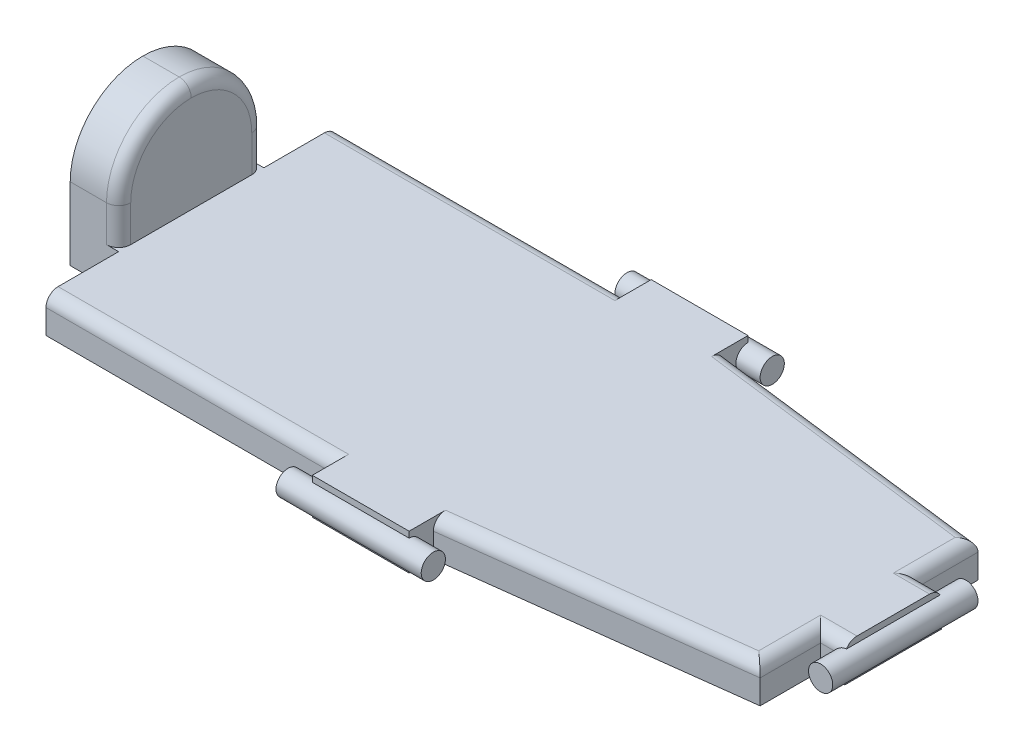
from build123d import *

# Parameters (mm, degrees)
BOSS_EXTRUDE2_DEPTH = 15
SKETCH3_W           = 40
SKETCH3_H           = 15
BOSS_EXTRUDE3_DEPTH = 10
BOSS_EXTRUDE4_START = -50
SKETCH4_R           = 5
BOSS_EXTRUDE4_DEPTH = 60
SKETCH5_W           = 20
SKETCH5_H           = 15
BOSS_EXTRUDE5_DEPTH = 10
BOSS_EXTRUDE6_START = -20
SKETCH6_R           = 5
BOSS_EXTRUDE6_DEPTH = 30
SKETCH7_W           = 20
SKETCH7_H           = 60
BOSS_EXTRUDE7_DEPTH = 60
SKETCH9_R           = 15
CUT_EXTRUDE1_DEPTH  = 5
SKETCH10_R          = 18
CUT_EXTRUDE2_DEPTH  = 5
FILLET1_R           = 30
FILLET2_R           = 5


with BuildPart() as part:
    # Sketch1 → Boss-Extrude2 (new body)
    with BuildSketch(Plane(origin=(0, 0, 0), x_dir=(1, 0, 0), z_dir=(0, 1, 0))):
        Polygon((0, 0), (300, 0), (300, -45), (180, -60), (20, -60), (20, -30), (0, -30), align=None)
    boss_extrude2 = extrude(amount=BOSS_EXTRUDE2_DEPTH)

    # Sketch3 → Boss-Extrude3 (add)
    with BuildSketch(Plane.XY.offset(60)):
        with Locations((160, 7.5)):
            Rectangle(SKETCH3_W, SKETCH3_H)
    boss_extrude3 = extrude(amount=BOSS_EXTRUDE3_DEPTH)

    # Sketch4 → Boss-Extrude4 (add)
    with BuildSketch(Plane(origin=(180, 0, 0), x_dir=(0, 0, -1), z_dir=(1, 0, 0)).offset(BOSS_EXTRUDE4_START)):
        with Locations((-70, 7.5)):
            Circle(SKETCH4_R)
    boss_extrude4 = extrude(amount=BOSS_EXTRUDE4_DEPTH)

    # Sketch5 → Boss-Extrude5 (add)
    with BuildSketch(Plane(origin=(300, 0, 0), x_dir=(0, 0, -1), z_dir=(1, 0, 0))):
        with Locations((-10, 7.5)):
            Rectangle(SKETCH5_W, SKETCH5_H)
    boss_extrude5 = extrude(amount=BOSS_EXTRUDE5_DEPTH)

    # Sketch6 → Boss-Extrude6 (add)
    with BuildSketch(Plane.XY.offset(20).offset(BOSS_EXTRUDE6_START)):
        with Locations((310, 7.5)):
            Circle(SKETCH6_R)
    boss_extrude6 = extrude(amount=BOSS_EXTRUDE6_DEPTH)

    # Mirror1: Boss-Extrude2, Boss-Extrude3, Boss-Extrude4, Boss-Extrude5, Boss-Extrude6 across plane
    add(boss_extrude2.mirror(Plane(origin=(0, 15, 0), x_dir=(1, 0, 0), z_dir=(0, 0, 1))))
    add(boss_extrude3.mirror(Plane(origin=(0, 15, 0), x_dir=(1, 0, 0), z_dir=(0, 0, 1))))
    add(boss_extrude4.mirror(Plane(origin=(0, 15, 0), x_dir=(1, 0, 0), z_dir=(0, 0, 1))))
    add(boss_extrude5.mirror(Plane(origin=(0, 15, 0), x_dir=(1, 0, 0), z_dir=(0, 0, 1))))
    add(boss_extrude6.mirror(Plane(origin=(0, 15, 0), x_dir=(1, 0, 0), z_dir=(0, 0, 1))))

    # Sketch7 → Boss-Extrude7 (add)
    with BuildSketch(Plane(origin=(0, 0, 0), x_dir=(1, 0, 0), z_dir=(0, 1, 0))):
        with Locations((10, 0)):
            Rectangle(SKETCH7_W, SKETCH7_H)
    extrude(amount=BOSS_EXTRUDE7_DEPTH)

    # Sketch9 → Cut-Extrude1 (cut)
    with BuildSketch(Plane.ZY):
        with Locations((0, 35)):
            Circle(SKETCH9_R)
    extrude(amount=-CUT_EXTRUDE1_DEPTH, mode=Mode.SUBTRACT)

    # Sketch10 → Cut-Extrude2 (cut)
    with BuildSketch(Plane.ZY.offset(-5)):
        with Locations((0, 35)):
            Circle(SKETCH10_R)
    extrude(amount=-CUT_EXTRUDE2_DEPTH, mode=Mode.SUBTRACT)

    # Fillet1
    fillet1_edges = [part.edges().sort_by_distance(p)[0] for p in [
        (10, 60, -30),
        (10, 60, 30),
    ]]
    fillet(fillet1_edges, radius=FILLET1_R - 0.0001)  # a hair under: the kernel refuses the full size

    # Fillet2
    fillet2_edges = [part.edges().sort_by_distance(p)[0] for p in [
        (20, 22.50005, -30),
        (20, 51.213232725, -21.213232725),
        (20, 22.50005, 30),
        (240, 15, -52.5),
        (300, 15, -32.5),
        (305, 15, -20),
        (305, 15, 20),
        (300, 15, 32.5),
        (240, 15, 52.5),
        (80, 15, -60),
        (80, 15, 60),
        (20, 51.213232725, 21.213232725),
    ]]
    fillet(fillet2_edges, radius=FILLET2_R)


solid = part.part
